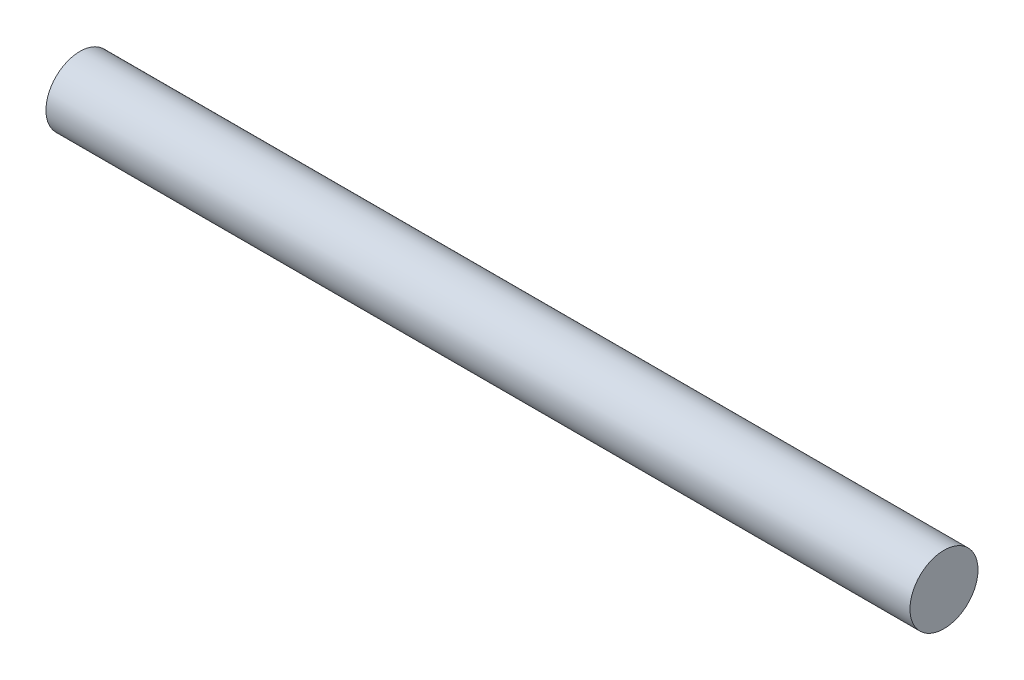
from build123d import *

# Parameters (mm, degrees)
SKETCH1_R  = 2.5
BASE_DEPTH = 63.5


with BuildPart() as part:
    # Sketch1 → Base (new body)
    with BuildSketch(Plane(origin=(0, 0, 0), x_dir=(0, 0, -1), z_dir=(1, 0, 0))):
        Circle(SKETCH1_R)
    extrude(amount=BASE_DEPTH)


solid = part.part
